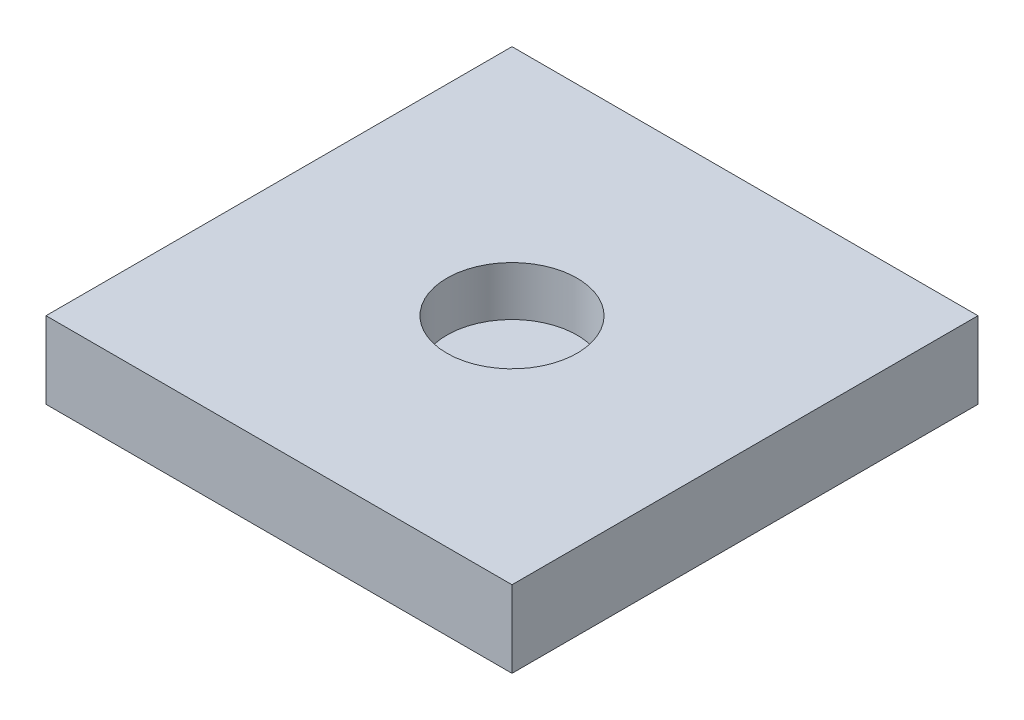
from build123d import *

# Parameters (mm, degrees)
SKETCH1_W           = 340
SKETCH1_H           = 340
BOSS_EXTRUDE1_DEPTH = 56
SKETCH2_R           = 47.5
CUT_EXTRUDE1_DEPTH  = 36


with BuildPart() as part:
    # Sketch1 → Boss-Extrude1 (new body)
    with BuildSketch(Plane(origin=(0, 0, 0), x_dir=(1, 0, 0), z_dir=(0, 1, 0))):
        Rectangle(SKETCH1_W, SKETCH1_H)
    extrude(amount=BOSS_EXTRUDE1_DEPTH)

    # Sketch2 → Cut-Extrude1 (cut)
    with BuildSketch(Plane(origin=(0, 56, 0), x_dir=(1, 0, 0), z_dir=(0, 1, 0))):
        Circle(SKETCH2_R)
    extrude(amount=-CUT_EXTRUDE1_DEPTH, mode=Mode.SUBTRACT)


solid = part.part
